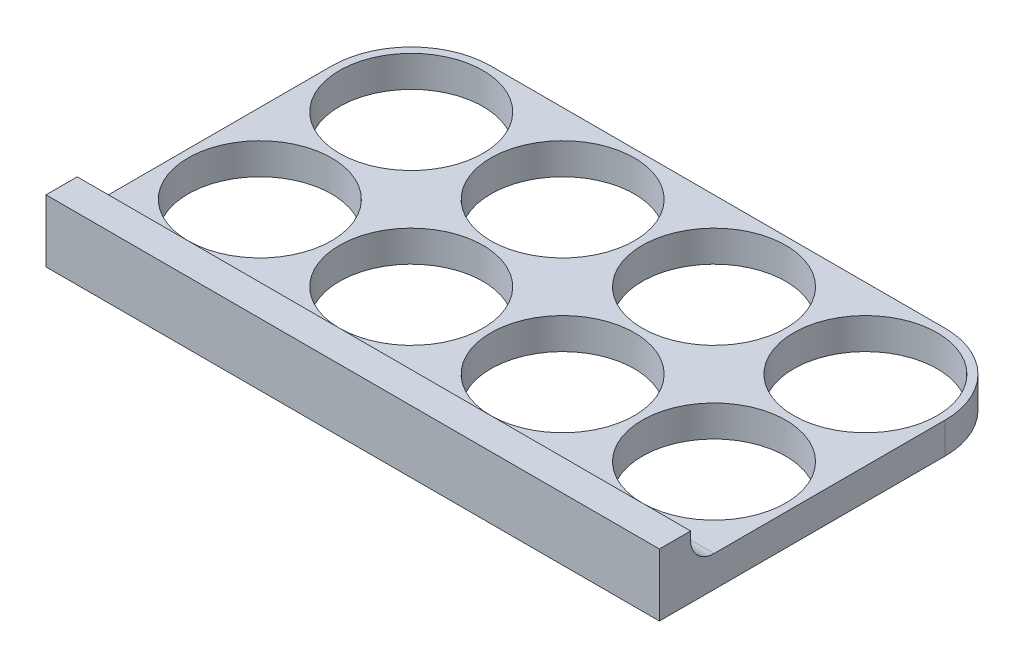
from build123d import *

# Parameters (mm, degrees)
SKETCH1_R           = 9.2
BOSS_EXTRUDE1_DEPTH = 4
SKETCH2_W           = 78.6
SKETCH2_H           = 4
BOSS_EXTRUDE2_DEPTH = 4
FILLET1_R           = 3


with BuildPart() as part:
    # Sketch1 → Boss-Extrude1 (new body)
    with BuildSketch(Plane(origin=(0, 0, 0), x_dir=(1, 0, 0), z_dir=(0, 1, 0))):
        with BuildLine():
            Line((-10.2, 0), (-10.2, -17.2))
            Line((-10.2, -17.2), (68.4, -17.2))
            Line((68.4, -17.2), (68.4, 0))
            Line((68.4, 0), (68.4, 19.4))
            ThreePointArc((68.4, 19.4), (65.412489168, 26.612489168), (58.2, 29.6))
            Line((58.2, 29.6), (0, 29.6))
            ThreePointArc((0, 29.6), (-7.212489168, 26.612489168), (-10.2, 19.4))
            Line((-10.2, 19.4), (-10.2, 0))
        make_face()
        Circle(SKETCH1_R, mode=Mode.SUBTRACT)
        with Locations((19.4, 0)):
            Circle(SKETCH1_R, mode=Mode.SUBTRACT)
        with Locations((38.8, 0)):
            Circle(SKETCH1_R, mode=Mode.SUBTRACT)
        with Locations((58.2, 0)):
            Circle(SKETCH1_R, mode=Mode.SUBTRACT)
        with Locations((19.4, 19.4)):
            Circle(SKETCH1_R, mode=Mode.SUBTRACT)
        with Locations((38.8, 19.4)):
            Circle(SKETCH1_R, mode=Mode.SUBTRACT)
        with Locations((58.2, 19.4)):
            Circle(SKETCH1_R, mode=Mode.SUBTRACT)
        with Locations((0, 19.4)):
            Circle(SKETCH1_R, mode=Mode.SUBTRACT)
    extrude(amount=BOSS_EXTRUDE1_DEPTH)

    # Sketch2 → Boss-Extrude2 (add)
    with BuildSketch(Plane(origin=(0, 4, 0), x_dir=(1, 0, 0), z_dir=(0, 1, 0))):
        with Locations((29.1, -15.2)):
            Rectangle(SKETCH2_W, SKETCH2_H)
    extrude(amount=BOSS_EXTRUDE2_DEPTH)

    # Fillet1
    fillet1_edges = [part.edges().sort_by_distance(p)[0] for p in [
        (29.1, 4, 13.2),
    ]]
    fillet(fillet1_edges, radius=FILLET1_R)


solid = part.part
